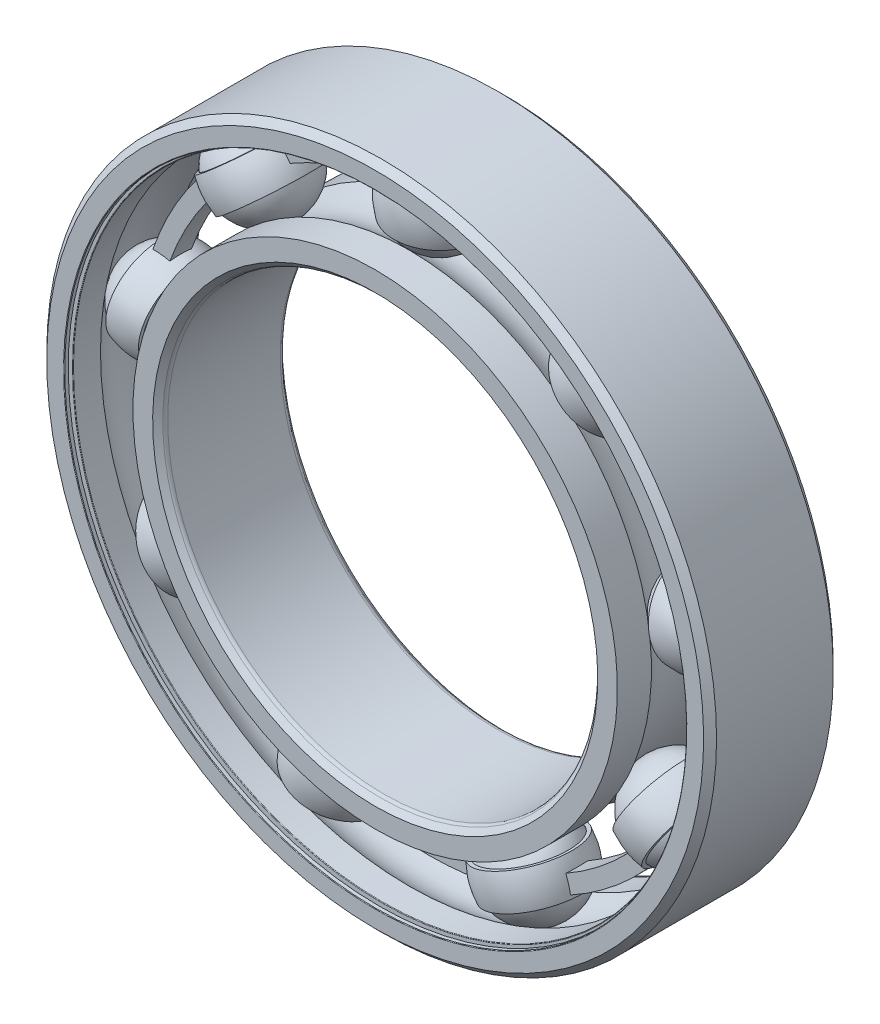
from build123d import *

# Parameters (mm, degrees)
BOSS_EXTRUDE1_DEPTH = 1
CIRPATTERN1_COUNT   = 9
CIRPATTERN2_COUNT   = 9
FILLET1_R           = 0.054
FILLET2_R           = 0.44999999999999996


with BuildPart() as part:
    # Sketch3 → Revolve1 (revolve)
    with BuildSketch(Plane(origin=(0, 0, 0), x_dir=(0, 0, -1), z_dir=(1, 0, 0)), mode=Mode.PRIVATE) as revolve1_sk:
        with BuildLine():
            Line((5.400000000000002, 31), (6.000000000000002, 30.40000000000001))
            Line((6.000000000000002, 30.40000000000001), (6.000000000000002, 28.576673076923075))
            Line((6.000000000000002, 28.576673076923075), (2.8500000000000036, 28.576673076923075))
            ThreePointArc((2.8500000000000036, 28.576673076923075), (2.95e-15, 29.693788104417003), (-2.8499999999999965, 28.576673076923075))
            Line((-2.8499999999999965, 28.576673076923075), (-5.999999999999993, 28.576673076923075))
            Line((-5.999999999999993, 28.576673076923075), (-5.999999999999993, 30.40000000000001))
            Line((-5.999999999999993, 30.40000000000001), (-5.399999999999993, 31))
            Line((-5.399999999999993, 31), (5.400000000000002, 31))
        make_face()
    revolve(revolve1_sk.sketch.rotate(Axis((0, 0, 5.999999999999998), (0, 1.8e-16, -1)), 180), axis=Axis((0, 0, 5.999999999999998), (0, 1.8e-16, -1)))

    # Sketch8 → Cut-Revolve1 (revolve, cut)
    with BuildSketch(Plane(origin=(0, 0, 0), x_dir=(0, 0, -1), z_dir=(1, 0, 0)), mode=Mode.PRIVATE) as cut_revolve1_sk:
        Polygon((-5.616, 28.576673076923072), (-5.4, 28.576673076923075), (-5.4, 29.384448717948718), (-5.616, 29.384448717948715), (-5.616, 28.792673076923073), (-5.999999999999991, 28.792673076923073), (-5.999999999999993, 28.576673076923075), align=None)
        Polygon((5.4, 28.576673076923075), (5.616, 28.576673076923072), (6.000000000000002, 28.576673076923075), (6, 28.792673076923077), (5.616, 28.792673076923073), (5.616, 29.384448717948715), (5.4, 29.384448717948718), align=None)
    revolve(cut_revolve1_sk.sketch.rotate(Axis((0, 0, 5.999999999999998), (0, 1.8e-16, -1)), 180), axis=Axis((0, 0, 5.999999999999998), (0, 1.8e-16, -1)), mode=Mode.SUBTRACT)

    # Fillet1
    fillet1_edges = [part.edges().sort_by_distance(p)[0] for p in [
        (-7.05e-15, 28.792673076923073, 5.999999999999991),
        (-7e-15, 28.576673076923075, 5.4),
        (-7.05e-15, 28.792673076923077, -6),
        (-7e-15, 28.576673076923075, -5.4),
    ]]
    fillet(fillet1_edges, radius=FILLET1_R)


with BuildPart() as body_2:
    # Sketch4 → Revolve2 (revolve)
    with BuildSketch(Plane(origin=(0, 0, 0), x_dir=(0, 0, -1), z_dir=(1, 0, 0)), mode=Mode.PRIVATE) as revolve2_sk:
        with BuildLine():
            Line((-5.4, 19.9995), (-6.000000000000011, 20.599499999999978))
            Line((-6.000000000000011, 20.599499999999978), (-6.000000000000011, 22.422826923076915))
            Line((-6.000000000000011, 22.422826923076915), (-2.8499999999999837, 22.422826923076915))
            ThreePointArc((-2.8499999999999837, 22.422826923076915), (1.09e-15, 21.305711895583002), (2.8499999999999837, 22.422826923076915))
            Line((2.8499999999999837, 22.422826923076915), (6.000000000000011, 22.422826923076915))
            Line((6.000000000000011, 22.422826923076915), (6.000000000000011, 20.599499999999978))
            Line((6.000000000000011, 20.599499999999978), (5.4, 19.9995))
            Line((5.4, 19.9995), (-5.4, 19.9995))
        make_face()
    revolve(revolve2_sk.sketch.rotate(Axis((0, 0, 5.999999999999998), (0, 1.8e-16, -1)), 180), axis=Axis((0, 0, 5.999999999999998), (0, 1.8e-16, -1)))

    # Fillet2
    fillet2_edges = [body_2.edges().sort_by_distance(p)[0] for p in [
        (-4.9e-15, 19.9995, 5.4),
        (-4.9e-15, 19.9995, -5.4),
    ]]
    fillet(fillet2_edges, radius=FILLET2_R)


with BuildPart() as body_3:
    # Sketch5 → Revolve3 (revolve)
    with BuildSketch(Plane(origin=(0, 0, 0), x_dir=(0, 0, -1), z_dir=(1, 0, 0))):
        with BuildLine():
            Line((-4.194038104416999, 25.499750000000002), (4.194038104417005, 25.499750000000002))
            ThreePointArc((4.194038104417005, 25.499750000000002), (2.95e-15, 29.693788104417003), (-4.194038104416999, 25.499750000000002))
        make_face()
    revolve(axis=Axis((0, 25.499750000000002, 4.194038104416999), (0, 0, -1)))


with BuildPart() as body_4:
    # Sketch6 → Revolve4 (revolve)
    with BuildSketch(Plane(origin=(0, 0, 0), x_dir=(0, 0, -1), z_dir=(1, 0, 0))):
        with BuildLine():
            Line((-3.901678064112447, 27.038211538461535), (-4.251398386760372, 27.038211538461535))
            ThreePointArc((-4.251398386760372, 27.038211538461535), (-4.426258548084334, 25.499749999999995), (-4.251398386760372, 23.961288461538455))
            Line((-4.251398386760372, 23.961288461538455), (-3.9016780641124478, 23.961288461538455))
            ThreePointArc((-3.9016780641124478, 23.961288461538455), (-4.194038104416995, 25.499749999999995), (-3.901678064112447, 27.038211538461535))
        make_face()
    revolve4 = revolve(axis=Axis((0, 31, 0), (0, -1, 0)))

    # Sketch7 → Boss-Extrude1 (add, symmetric)
    with BuildSketch(Plane.XY):
        with BuildLine():
            Line((16.390923350104206, 19.533941788423267), (17.379827365006562, 20.712471700914005))
            ThreePointArc((17.379827365006562, 20.712471700914005), (9.247612985654284, 25.40760786194074), (0, 27.038211538461535))
            Line((0, 27.038211538461535), (3.47e-15, 25.499750000000002))
            ThreePointArc((3.47e-15, 25.499750000000002), (8.721428149768645, 23.9619269068855), (16.390923350104206, 19.533941788423267))
        make_face()
    boss_extrude1 = extrude(amount=BOSS_EXTRUDE1_DEPTH, both=True)

    # CirPattern2: Revolve4, Boss-Extrude1 ×9 about axis
    cirpattern2_axis = Axis((-4e-16, -1.37e-15, 0), (0, 0, 1))
    add([revolve4.rotate(cirpattern2_axis, i * 360 / CIRPATTERN2_COUNT) for i in range(1, CIRPATTERN2_COUNT)])
    add([boss_extrude1.rotate(cirpattern2_axis, i * 360 / CIRPATTERN2_COUNT) for i in range(1, CIRPATTERN2_COUNT)])


with BuildPart() as cirpattern1_1:
    # CirPattern1: pattern copy
    add(body_3.part.rotate(Axis((2.4e-16, -1.05e-15, 0), (0, 0, 1)), 1 * 360 / CIRPATTERN1_COUNT))


with BuildPart() as cirpattern1_2:
    # CirPattern1: pattern copy
    add(body_3.part.rotate(Axis((2.4e-16, -1.05e-15, 0), (0, 0, 1)), 2 * 360 / CIRPATTERN1_COUNT))


with BuildPart() as cirpattern1_3:
    # CirPattern1: pattern copy
    add(body_3.part.rotate(Axis((2.4e-16, -1.05e-15, 0), (0, 0, 1)), 3 * 360 / CIRPATTERN1_COUNT))


with BuildPart() as cirpattern1_4:
    # CirPattern1: pattern copy
    add(body_3.part.rotate(Axis((2.4e-16, -1.05e-15, 0), (0, 0, 1)), 4 * 360 / CIRPATTERN1_COUNT))


with BuildPart() as cirpattern1_5:
    # CirPattern1: pattern copy
    add(body_3.part.rotate(Axis((2.4e-16, -1.05e-15, 0), (0, 0, 1)), 5 * 360 / CIRPATTERN1_COUNT))


with BuildPart() as cirpattern1_6:
    # CirPattern1: pattern copy
    add(body_3.part.rotate(Axis((2.4e-16, -1.05e-15, 0), (0, 0, 1)), 6 * 360 / CIRPATTERN1_COUNT))


with BuildPart() as cirpattern1_7:
    # CirPattern1: pattern copy
    add(body_3.part.rotate(Axis((2.4e-16, -1.05e-15, 0), (0, 0, 1)), 7 * 360 / CIRPATTERN1_COUNT))


with BuildPart() as cirpattern1_8:
    # CirPattern1: pattern copy
    add(body_3.part.rotate(Axis((2.4e-16, -1.05e-15, 0), (0, 0, 1)), 8 * 360 / CIRPATTERN1_COUNT))


solid = Compound([part.part, body_2.part, body_3.part, body_4.part, cirpattern1_1.part, cirpattern1_2.part, cirpattern1_3.part, cirpattern1_4.part, cirpattern1_5.part, cirpattern1_6.part, cirpattern1_7.part, cirpattern1_8.part])
